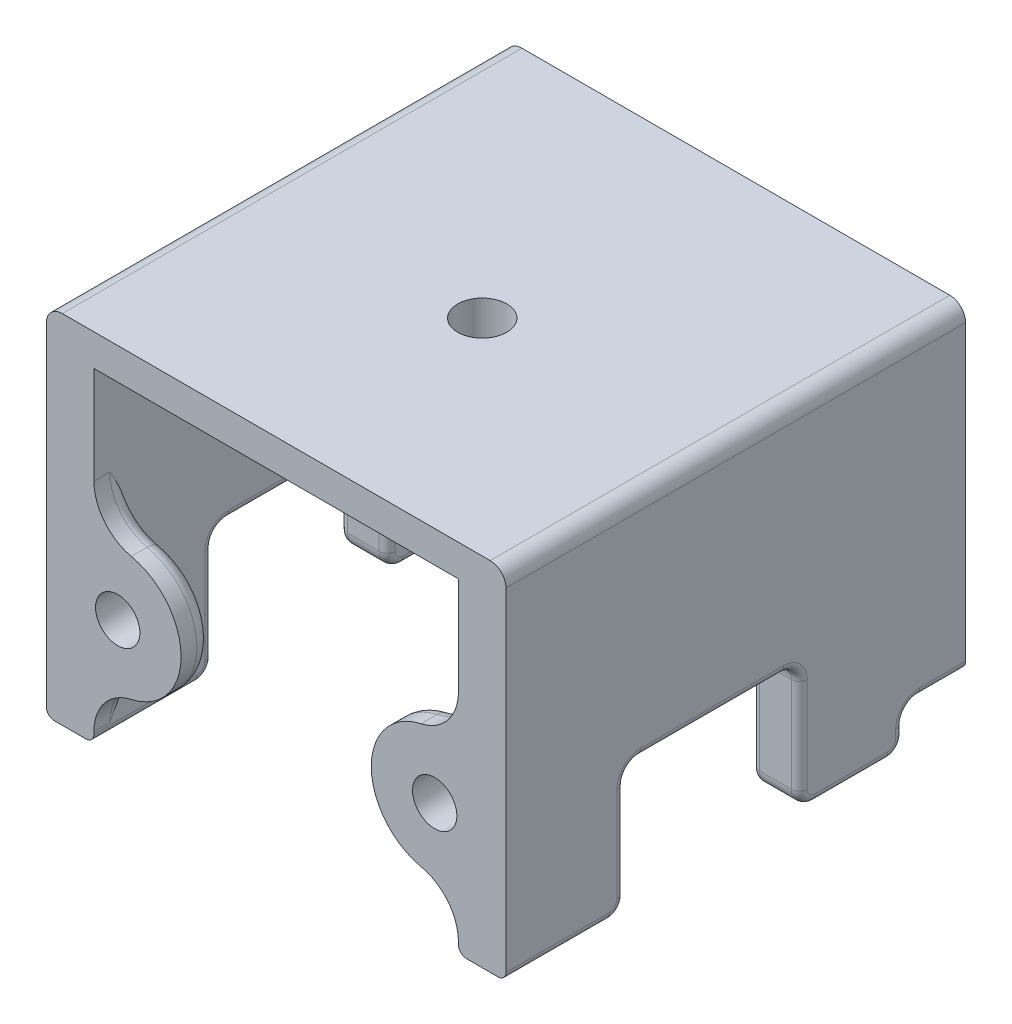
from build123d import *
from OCP.BRepFilletAPI import BRepFilletAPI_MakeChamfer

# Parameters (mm, degrees)
SKIZZE1_W                            = 58
SKIZZE1_H                            = 40
SKIZZE1_R                            = 2.4
SKIZZE1_R_2                          = 1.6
AUFSATZ_LINEAR_AUSTRAGEN1_DEPTH      = 8
AUFSATZ_LINEAR_AUSTRAGEN2_DEPTH      = 50
SCHNITT_LINEAR_AUSTRAGEN6_DEPTH      = 10
SCHNITT_LINEAR_AUSTRAGEN6_DEPTH_BACK = 4
SKIZZE10_R                           = 8
AUFSATZ_LINEAR_AUSTRAGEN3_DEPTH      = 4
SKIZZE13_W                           = 6
SKIZZE13_H                           = 50.174433159
AUFSATZ_LINEAR_AUSTRAGEN4_DEPTH      = 5
VERRUNDUNG1_R                        = 6
VERRUNDUNG3_R                        = 2
SKIZZE11_R                           = 2.8
SCHNITT_LINEAR_AUSTRAGEN7_DEPTH      = 4
SKIZZE7_R                            = 2
SCHNITT_LINEAR_AUSTRAGEN2_DEPTH      = 14
VERRUNDUNG4_R                        = 2
SKIZZE12_W                           = 58
SKIZZE12_H                           = 22
SCHNITT_LINEAR_AUSTRAGEN8_DEPTH      = 16
VERRUNDUNG5_R                        = 2
FASE4_SIZE                           = 4.5
FASE4_SIZE2                          = 1.205771366
LINEARES_MUSTER1_COUNT               = 2
LINEARES_MUSTER1_PITCH               = 52
VERRUNDUNG6_R                        = 1
SKIZZE16_R                           = 16
AUFSATZ_LINEAR_AUSTRAGEN7_DEPTH      = 20
FASE8_SIZE                           = 12
FASE8_SIZE2                          = 6.92820323
SKIZZE18_R                           = 3.1
SCHNITT_LINEAR_AUSTRAGEN10_DEPTH     = 20


# Read off the part's stored shape, not the designer's step: Aufsatz-Linear austragen2
with BuildPart() as part:
    # Skizze1 → Aufsatz-Linear austragen1 (new body)
    with BuildSketch(Plane.XY):
        with Locations((0, -20)):
            Rectangle(SKIZZE1_W, SKIZZE1_H)
        with Locations((-20, -10)):
            Circle(SKIZZE1_R, mode=Mode.SUBTRACT)
        with Locations((0, -10)):
            Circle(SKIZZE1_R, mode=Mode.SUBTRACT)
        with Locations((20, -10)):
            Circle(SKIZZE1_R, mode=Mode.SUBTRACT)
        with Locations((0, -30)):
            Circle(SKIZZE1_R, mode=Mode.SUBTRACT)
        with Locations((20, -30)):
            Circle(SKIZZE1_R, mode=Mode.SUBTRACT)
        with Locations((-20, -30)):
            Circle(SKIZZE1_R, mode=Mode.SUBTRACT)
        with Locations((-10, -20)):
            Circle(SKIZZE1_R_2, mode=Mode.SUBTRACT)
        with Locations((10, -20)):
            Circle(SKIZZE1_R_2, mode=Mode.SUBTRACT)
    extrude(amount=AUFSATZ_LINEAR_AUSTRAGEN1_DEPTH)

    # Aufsatz-Linear austragen2 outline → Aufsatz-Linear austragen2 (add)
    with BuildSketch(Plane.XY.offset(8)):
        Polygon((23, -40), (29, -40), (29, 0), (-29, 0), (-29, -40), (-23, -40), (-23, -4), (23, -4), align=None)
    extrude(amount=AUFSATZ_LINEAR_AUSTRAGEN2_DEPTH)

    # Skizze9 → Schnitt-Linear austragen6 (cut, two sides: drawn at the far end of the back side and taken through both)
    with BuildSketch(Plane.XY.offset(8).offset(-SCHNITT_LINEAR_AUSTRAGEN6_DEPTH_BACK)):
        Polygon((3.5, -7.979274058), (0, -5.958548116), (-3.5, -7.979274058), (-3.5, -12.020725942), (0, -14.041451884), (3.5, -12.020725942), align=None)
        Polygon((-16.5, -7.979274058), (-20, -5.958548116), (-23.5, -7.979274058), (-23.5, -12.020725942), (-20, -14.041451884), (-16.5, -12.020725942), align=None)
        Polygon((23.5, -7.979274058), (20, -5.958548116), (16.5, -7.979274058), (16.5, -12.020725942), (20, -14.041451884), (23.5, -12.020725942), align=None)
        Polygon((3.5, -27.979274058), (0, -25.958548116), (-3.5, -27.979274058), (-3.5, -32.020725942), (0, -34.041451884), (3.5, -32.020725942), align=None)
        Polygon((23.5, -27.979274058), (20, -25.958548116), (16.5, -27.979274058), (16.5, -32.020725942), (20, -34.041451884), (23.5, -32.020725942), align=None)
        Polygon((-16.5, -27.979274058), (-20, -25.958548116), (-23.5, -27.979274058), (-23.5, -32.020725942), (-20, -34.041451884), (-16.5, -32.020725942), align=None)
    extrude(amount=SCHNITT_LINEAR_AUSTRAGEN6_DEPTH + SCHNITT_LINEAR_AUSTRAGEN6_DEPTH_BACK, mode=Mode.SUBTRACT)

    # Skizze10 → Aufsatz-Linear austragen3 (add)
    with BuildSketch(Plane.XY.offset(58)):
        with Locations((20, -30)):
            Circle(SKIZZE10_R)
        with Locations((-20, -30)):
            Circle(SKIZZE10_R)
    extrude(amount=-AUFSATZ_LINEAR_AUSTRAGEN3_DEPTH)

    # Skizze13 → Aufsatz-Linear austragen4 (add)
    with BuildSketch(Plane.XZ.offset(40)):
        with Locations((-26, 32.912783421)):
            Rectangle(SKIZZE13_W, SKIZZE13_H)
        with Locations((26, 32.912783421)):
            Rectangle(SKIZZE13_W, SKIZZE13_H)
    extrude(amount=AUFSATZ_LINEAR_AUSTRAGEN4_DEPTH)

    # Verrundung1
    verrundung1_edges = [part.edges().sort_by_distance(p)[0] for p in [
        (23, -37.416198487, 56),
        (23, -22.583801513, 56),
        (-23, -37.416198487, 56),
        (-23, -22.583801513, 56),
    ]]
    fillet(verrundung1_edges, radius=VERRUNDUNG1_R)

    # Verrundung3
    # the kernel refuses this fillet: 2 mm, written as the material it takes off along each edge
    with BuildSketch(Plane(origin=(-20, -30, 54), x_dir=(0.21428571428571433, -0.9767710236555245, 0), z_dir=(-0.9767710236555245, -0.21428571428571433, 0))) as verrundung3_piece_1:
        with BuildLine():
            CenterArc((8 - VERRUNDUNG3_R, VERRUNDUNG3_R), VERRUNDUNG3_R, 270, 90)
            Line((8 - VERRUNDUNG3_R, 0), (8, 0))
            Line((8, 0), (8, VERRUNDUNG3_R))
        make_face()
    revolve(axis=Axis((-20, -30, 54), (0, 0, 1)), revolution_arc=155.252749768, mode=Mode.SUBTRACT)
    with BuildSketch(Plane(origin=(20, -30, 54), x_dir=(-0.21428571428571433, 0.9767710236555245, 0), z_dir=(0.9767710236555245, 0.21428571428571433, 0))) as verrundung3_piece_2:
        with BuildLine():
            CenterArc((8 - VERRUNDUNG3_R, VERRUNDUNG3_R), VERRUNDUNG3_R, 270, 90)
            Line((8 - VERRUNDUNG3_R, 0), (8, 0))
            Line((8, 0), (8, VERRUNDUNG3_R))
        make_face()
    revolve(axis=Axis((20, -30, 54), (0, 0, 1)), revolution_arc=155.252749768, mode=Mode.SUBTRACT)
    with BuildSketch(Plane(origin=(-17, -16.325205669, 54), x_dir=(-0.6722279054593165, 0.7403442733767718, 0), z_dir=(0.7403442733767718, 0.6722279054593165, 0))) as verrundung3_piece_3_section:
        with BuildLine():
            CenterArc((6 + VERRUNDUNG3_R, VERRUNDUNG3_R), VERRUNDUNG3_R, 180, 90)
            Line((6 + VERRUNDUNG3_R, 0), (6, 0))
            Line((6, 0), (6, VERRUNDUNG3_R))
        make_face()
    verrundung3_piece_3 = revolve(axis=Axis((-17, -16.325205669, 54), (0, 0, 1)), revolution_arc=125.387125524, mode=Mode.PRIVATE)
    verrundung3_piece_3 = split(verrundung3_piece_3, bisect_by=Plane(origin=(-23, -20.355034942, 54.516064296), z_dir=(1, 0, 0)), keep=Keep.TOP, mode=Mode.PRIVATE)
    add(verrundung3_piece_3, mode=Mode.SUBTRACT)
    with BuildSketch(Plane(origin=(-17, -43.674794331, 54), x_dir=(-0.6722279054593165, -0.7403442733767718, 0), z_dir=(0.7403442733767718, -0.6722279054593165, 0))) as verrundung3_piece_4_section:
        with BuildLine():
            CenterArc((6 + VERRUNDUNG3_R, -VERRUNDUNG3_R), VERRUNDUNG3_R, 90, 90)
            Line((6, -VERRUNDUNG3_R), (6, 0))
            Line((6, 0), (6 + VERRUNDUNG3_R, 0))
        make_face()
    verrundung3_piece_4 = revolve(axis=Axis((-17, -43.674794331, 54), (0, 0, -1)), revolution_arc=125.387125524, mode=Mode.PRIVATE)
    verrundung3_piece_4 = split(verrundung3_piece_4, bisect_by=Plane(origin=(-23, -39.644965239, 54.51606418), z_dir=(1, 0, 0)), keep=Keep.TOP, mode=Mode.PRIVATE)
    add(verrundung3_piece_4, mode=Mode.SUBTRACT)
    with BuildSketch(Plane(origin=(17, -43.674794331, 54), x_dir=(0.6722279054593165, -0.7403442733767718, 0), z_dir=(-0.7403442733767718, -0.6722279054593165, 0))) as verrundung3_piece_5_section:
        with BuildLine():
            CenterArc((6 + VERRUNDUNG3_R, VERRUNDUNG3_R), VERRUNDUNG3_R, 180, 90)
            Line((6 + VERRUNDUNG3_R, 0), (6, 0))
            Line((6, 0), (6, VERRUNDUNG3_R))
        make_face()
    verrundung3_piece_5 = revolve(axis=Axis((17, -43.674794331, 54), (0, 0, 1)), revolution_arc=125.387125524, mode=Mode.PRIVATE)
    verrundung3_piece_5 = split(verrundung3_piece_5, bisect_by=Plane(origin=(23, -39.644963205, 54.516060737), z_dir=(-1, 0, 0)), keep=Keep.TOP, mode=Mode.PRIVATE)
    add(verrundung3_piece_5, mode=Mode.SUBTRACT)
    with BuildSketch(Plane(origin=(17, -16.325205669, 54), x_dir=(0.672227905459316, 0.7403442733767723, 0), z_dir=(-0.7403442733767723, 0.672227905459316, 0))) as verrundung3_piece_6_section:
        with BuildLine():
            CenterArc((6 + VERRUNDUNG3_R, -VERRUNDUNG3_R), VERRUNDUNG3_R, 90, 90)
            Line((6, -VERRUNDUNG3_R), (6, 0))
            Line((6, 0), (6 + VERRUNDUNG3_R, 0))
        make_face()
    verrundung3_piece_6 = revolve(axis=Axis((17, -16.325205669, 54), (0, 0, -1)), revolution_arc=125.387125524, mode=Mode.PRIVATE)
    verrundung3_piece_6 = split(verrundung3_piece_6, bisect_by=Plane(origin=(23, -20.355037546, 54.516064213), z_dir=(-1, 0, 0)), keep=Keep.TOP, mode=Mode.PRIVATE)
    add(verrundung3_piece_6, mode=Mode.SUBTRACT)

    # Skizze11 → Schnitt-Linear austragen7 (cut)
    with BuildSketch(Plane.XY.offset(58)):
        with Locations((20, -30)):
            Circle(SKIZZE11_R)
        with Locations((-20, -30)):
            Circle(SKIZZE11_R)
    extrude(amount=-SCHNITT_LINEAR_AUSTRAGEN7_DEPTH, mode=Mode.SUBTRACT)

    # Skizze7 → Schnitt-Linear austragen2 (cut)
    with BuildSketch(Plane.XZ.offset(45)):
        with Locations(Location((26, 15.300827002, 0), (0, 0, 270))):
            Circle(SKIZZE7_R)
        with Locations(Location((26, 50.800827002, 0), (0, 0, 270))):
            Circle(SKIZZE7_R)
    schnitt_linear_austragen2 = extrude(amount=-SCHNITT_LINEAR_AUSTRAGEN2_DEPTH, mode=Mode.SUBTRACT)

    # Verrundung4
    verrundung4_edges = [part.edges().sort_by_distance(p)[0] for p in [
        (-29, 0, 29),
        (29, 0, 29),
    ]]
    fillet(verrundung4_edges, radius=VERRUNDUNG4_R)

    # Skizze12 → Schnitt-Linear austragen8 (cut)
    with BuildSketch(Plane.XZ.offset(45)):
        with Locations((0, 32)):
            Rectangle(SKIZZE12_W, SKIZZE12_H)
    extrude(amount=-SCHNITT_LINEAR_AUSTRAGEN8_DEPTH, mode=Mode.SUBTRACT)

    # Verrundung5
    verrundung5_edges = [part.edges().sort_by_distance(p)[0] for p in [
        (-26, -40, 7.825566841),
        (-26, -45, 7.825566841),
        (26, -40, 7.825566841),
        (26, -45, 7.825566841),
        (26, -45, 21),
        (-26, -45, 21),
        (-26, -45, 43),
        (-26, -29, 43),
        (-26, -29, 21),
        (26, -29, 43),
        (26, -29, 21),
        (26, -45, 43),
    ]]
    fillet(verrundung5_edges, radius=VERRUNDUNG5_R)

    # Fase4: one chamfer whose edges measure the first distance from different faces: ONE call of the kernel's chamfer builder (chamfer() names one face for all edges)
    fase4_edges_1 = [part.edges().sort_by_distance(p)[0] for p in [
        (-11.6, -20, 0),
    ]]
    fase4_side_1 = [part.faces().sort_by_distance(p)[0] for p in [
        (-11.6, -20, 4),
    ]]
    fase4_edges_2 = [part.edges().sort_by_distance(p)[0] for p in [
        (8.4, -20, 0),
    ]]
    fase4_side_2 = [part.faces().sort_by_distance(p)[0] for p in [
        (8.4, -20, 4),
    ]]
    fase4 = BRepFilletAPI_MakeChamfer(part.part.solid().wrapped)
    for e in fase4_edges_1:
        fase4.Add(FASE4_SIZE, FASE4_SIZE2, e.wrapped, fase4_side_1[0].wrapped)  # the first distance lies on this face
    for e in fase4_edges_2:
        fase4.Add(FASE4_SIZE, FASE4_SIZE2, e.wrapped, fase4_side_2[0].wrapped)  # the first distance lies on this face
    add(Compound.cast(fase4.Shape()), mode=Mode.REPLACE)

    # Lineares Muster1: Schnitt-Linear austragen2 ×2
    with Locations(*[(-i * LINEARES_MUSTER1_PITCH, 0, 0) for i in range(1, LINEARES_MUSTER1_COUNT)]):
        add(schnitt_linear_austragen2, mode=Mode.SUBTRACT)

    # Verrundung6
    # the kernel refuses this fillet: 1 mm, written as the material it takes off along each edge
    with BuildSketch(Plane(origin=(-23, -42, 5.825566841), x_dir=(0, 0.3148458040869784, -0.9491428341660828), z_dir=(0, -0.9491428341660828, -0.3148458040869784))) as verrundung6_piece_1_section:
        with BuildLine():
            CenterArc((2 + VERRUNDUNG6_R, -VERRUNDUNG6_R), VERRUNDUNG6_R, 90, 90)
            Line((2, -VERRUNDUNG6_R), (2, 0))
            Line((2, 0), (2 + VERRUNDUNG6_R, 0))
        make_face()
    verrundung6_piece_1 = revolve(axis=Axis((-23, -42, 5.825566841), (1, 0, 0)), revolution_arc=161.648494619, mode=Mode.PRIVATE)
    verrundung6_piece_1 = split(verrundung6_piece_1, bisect_by=Plane(origin=(-23.272151062, -40, 7.287763131), z_dir=(0, -1, 0)), keep=Keep.TOP, mode=Mode.PRIVATE)
    add(verrundung6_piece_1, mode=Mode.SUBTRACT)
    with BuildSketch(Plane(origin=(-23, -42, 5.825566841), x_dir=(0, 0.3148458040869784, -0.9491428341660828), z_dir=(0, -0.9491428341660828, -0.3148458040869784))) as verrundung6_piece_2_section:
        with BuildLine():
            CenterArc((2 + VERRUNDUNG6_R, -VERRUNDUNG6_R), VERRUNDUNG6_R, 90, 90)
            Line((2, -VERRUNDUNG6_R), (2, 0))
            Line((2, 0), (2 + VERRUNDUNG6_R, 0))
        make_face()
    verrundung6_piece_2 = revolve(axis=Axis((-23, -42, 5.825566841), (1, 0, 0)), revolution_arc=161.648494619, mode=Mode.PRIVATE)
    verrundung6_piece_2 = split(verrundung6_piece_2, bisect_by=Plane(origin=(-23.00020869, -39.986552232, 8), z_dir=(0, 0, 1)), keep=Keep.TOP, mode=Mode.PRIVATE)
    add(verrundung6_piece_2, mode=Mode.SUBTRACT)
    with BuildSketch(Plane(origin=(-23, -42, 7.825566841), x_dir=(0, 0, 1), z_dir=(0, -1, 0)), Plane(origin=(29, -42, 7.825566841), x_dir=(0, 0, 1), z_dir=(0, -1, 0))) as verrundung6_piece_3:
        with BuildLine():
            CenterArc((VERRUNDUNG6_R, VERRUNDUNG6_R), VERRUNDUNG6_R, 180, 90)
            Line((0, VERRUNDUNG6_R), (0, 0))
            Line((0, 0), (VERRUNDUNG6_R, 0))
        make_face()
    extrude(amount=1, mode=Mode.SUBTRACT)
    with BuildSketch(Plane(origin=(-23, -43, 9.825566841), x_dir=(0, -1, 0), z_dir=(0, 0, 1))) as verrundung6_piece_4:
        with BuildLine():
            CenterArc((2 - VERRUNDUNG6_R, -VERRUNDUNG6_R), VERRUNDUNG6_R, 0, 90)
            Line((2, -VERRUNDUNG6_R), (2, 0))
            Line((2, 0), (2 - VERRUNDUNG6_R, 0))
        make_face()
    revolve(axis=Axis((-23, -43, 9.825566841), (1, 0, 0)), revolution_arc=90, mode=Mode.SUBTRACT)
    with BuildSketch(Plane(origin=(-23, -45, 19), x_dir=(0, 1, 0), z_dir=(0, 0, -1)), Plane(origin=(-29, -45, 9.825566841), x_dir=(0, 1, 0), z_dir=(0, 0, 1)), Plane(origin=(23, -45, 9.825566841), x_dir=(0, 1, 0), z_dir=(0, 0, 1)), Plane(origin=(29, -45, 19), x_dir=(0, 1, 0), z_dir=(0, 0, -1))) as verrundung6_piece_5:
        with BuildLine():
            CenterArc((VERRUNDUNG6_R, -VERRUNDUNG6_R), VERRUNDUNG6_R, 90, 90)
            Line((0, -VERRUNDUNG6_R), (0, 0))
            Line((0, 0), (VERRUNDUNG6_R, 0))
        make_face()
    extrude(amount=9.174433159, mode=Mode.SUBTRACT)
    with BuildSketch(Plane(origin=(-23, -43, 19), x_dir=(0, 0, 1), z_dir=(0, 1, 0))) as verrundung6_piece_6:
        with BuildLine():
            CenterArc((2 - VERRUNDUNG6_R, -VERRUNDUNG6_R), VERRUNDUNG6_R, 0, 90)
            Line((2, -VERRUNDUNG6_R), (2, 0))
            Line((2, 0), (2 - VERRUNDUNG6_R, 0))
        make_face()
    revolve(axis=Axis((-23, -43, 19), (1, 0, 0)), revolution_arc=90, mode=Mode.SUBTRACT)
    with BuildSketch(Plane(origin=(-23, -43, 21), x_dir=(0, 0, -1), z_dir=(0, 1, 0)), Plane(origin=(-23, -31, 43), x_dir=(0, 0, 1), z_dir=(0, -1, 0)), Plane(origin=(-29, -43, 43), x_dir=(0, 0, 1), z_dir=(0, 1, 0)), Plane(origin=(23, -31, 21), x_dir=(0, 0, -1), z_dir=(0, -1, 0)), Plane(origin=(23, -43, 43), x_dir=(0, 0, 1), z_dir=(0, 1, 0)), Plane(origin=(29, -43, 21), x_dir=(0, 0, -1), z_dir=(0, 1, 0))) as verrundung6_piece_7:
        with BuildLine():
            CenterArc((VERRUNDUNG6_R, VERRUNDUNG6_R), VERRUNDUNG6_R, 180, 90)
            Line((0, VERRUNDUNG6_R), (0, 0))
            Line((0, 0), (VERRUNDUNG6_R, 0))
        make_face()
    extrude(amount=12, mode=Mode.SUBTRACT)
    with BuildSketch(Plane(origin=(-23, -31, 23), x_dir=(0, 1, 0), z_dir=(0, 0, 1))) as verrundung6_piece_8:
        with BuildLine():
            CenterArc((2 + VERRUNDUNG6_R, VERRUNDUNG6_R), VERRUNDUNG6_R, 180, 90)
            Line((2, VERRUNDUNG6_R), (2, 0))
            Line((2, 0), (2 + VERRUNDUNG6_R, 0))
        make_face()
    revolve(axis=Axis((-23, -31, 23), (-1, 0, 0)), revolution_arc=90, mode=Mode.SUBTRACT)
    with BuildSketch(Plane(origin=(-23, -29, 41), x_dir=(0, 1, 0), z_dir=(0, 0, -1)), Plane(origin=(-29, -29, 23), x_dir=(0, 1, 0), z_dir=(0, 0, 1)), Plane(origin=(23, -29, 23), x_dir=(0, 1, 0), z_dir=(0, 0, 1)), Plane(origin=(29, -29, 41), x_dir=(0, 1, 0), z_dir=(0, 0, -1))) as verrundung6_piece_9:
        with BuildLine():
            CenterArc((VERRUNDUNG6_R, -VERRUNDUNG6_R), VERRUNDUNG6_R, 90, 90)
            Line((0, -VERRUNDUNG6_R), (0, 0))
            Line((0, 0), (VERRUNDUNG6_R, 0))
        make_face()
    extrude(amount=18, mode=Mode.SUBTRACT)
    with BuildSketch(Plane(origin=(-23, -31, 41), x_dir=(0, 0, 1), z_dir=(0, -1, 0))) as verrundung6_piece_10:
        with BuildLine():
            CenterArc((2 + VERRUNDUNG6_R, VERRUNDUNG6_R), VERRUNDUNG6_R, 180, 90)
            Line((2, VERRUNDUNG6_R), (2, 0))
            Line((2, 0), (2 + VERRUNDUNG6_R, 0))
        make_face()
    revolve(axis=Axis((-23, -31, 41), (-1, 0, 0)), revolution_arc=90, mode=Mode.SUBTRACT)
    with BuildSketch(Plane(origin=(-23, -43, 45), x_dir=(0, -1, 0), z_dir=(0, 0, 1))) as verrundung6_piece_11:
        with BuildLine():
            CenterArc((2 - VERRUNDUNG6_R, -VERRUNDUNG6_R), VERRUNDUNG6_R, 0, 90)
            Line((2, -VERRUNDUNG6_R), (2, 0))
            Line((2, 0), (2 - VERRUNDUNG6_R, 0))
        make_face()
    revolve(axis=Axis((-23, -43, 45), (1, 0, 0)), revolution_arc=90, mode=Mode.SUBTRACT)
    with BuildSketch(Plane(origin=(-29, -40, -2.5), x_dir=(1, 0, 0), z_dir=(0, 0, 1)), Plane(origin=(29, -40, 5.825566841), x_dir=(-1, 0, 0), z_dir=(0, 0, -1))) as verrundung6_piece_12:
        with BuildLine():
            CenterArc((VERRUNDUNG6_R, VERRUNDUNG6_R), VERRUNDUNG6_R, 180, 90)
            Line((0, VERRUNDUNG6_R), (0, 0))
            Line((0, 0), (VERRUNDUNG6_R, 0))
        make_face()
    extrude(amount=8.325566841, mode=Mode.SUBTRACT)
    with BuildSketch(Plane(origin=(-29, -42, 5.825566841), x_dir=(0, 1, 0), z_dir=(0, 0, -1))) as verrundung6_piece_13:
        with BuildLine():
            CenterArc((2 + VERRUNDUNG6_R, VERRUNDUNG6_R), VERRUNDUNG6_R, 180, 90)
            Line((2, VERRUNDUNG6_R), (2, 0))
            Line((2, 0), (2 + VERRUNDUNG6_R, 0))
        make_face()
    revolve(axis=Axis((-29, -42, 5.825566841), (1, 0, 0)), revolution_arc=90, mode=Mode.SUBTRACT)
    with BuildSketch(Plane(origin=(-29, -42, 7.825566841), x_dir=(0, 0, 1), z_dir=(0, -1, 0)), Plane(origin=(23, -42, 7.825566841), x_dir=(0, 0, 1), z_dir=(0, -1, 0))) as verrundung6_piece_14:
        with BuildLine():
            CenterArc((VERRUNDUNG6_R, -VERRUNDUNG6_R), VERRUNDUNG6_R, 90, 90)
            Line((0, -VERRUNDUNG6_R), (0, 0))
            Line((0, 0), (VERRUNDUNG6_R, 0))
        make_face()
    extrude(amount=1, mode=Mode.SUBTRACT)
    with BuildSketch(Plane(origin=(-29, -43, 9.825566841), x_dir=(0, -1, 0), z_dir=(0, 0, 1))) as verrundung6_piece_15:
        with BuildLine():
            CenterArc((2 - VERRUNDUNG6_R, VERRUNDUNG6_R), VERRUNDUNG6_R, 270, 90)
            Line((2, VERRUNDUNG6_R), (2, 0))
            Line((2, 0), (2 - VERRUNDUNG6_R, 0))
        make_face()
    revolve(axis=Axis((-29, -43, 9.825566841), (1, 0, 0)), revolution_arc=90, mode=Mode.SUBTRACT)
    with BuildSketch(Plane(origin=(-29, -43, 19), x_dir=(0, 0, 1), z_dir=(0, 1, 0))) as verrundung6_piece_16:
        with BuildLine():
            CenterArc((2 - VERRUNDUNG6_R, VERRUNDUNG6_R), VERRUNDUNG6_R, 270, 90)
            Line((2, VERRUNDUNG6_R), (2, 0))
            Line((2, 0), (2 - VERRUNDUNG6_R, 0))
        make_face()
    revolve(axis=Axis((-29, -43, 19), (1, 0, 0)), revolution_arc=90, mode=Mode.SUBTRACT)
    with BuildSketch(Plane(origin=(-29, -43, 21), x_dir=(0, 0, -1), z_dir=(0, 1, 0)), Plane(origin=(29, -43, 43), x_dir=(0, 0, 1), z_dir=(0, 1, 0))) as verrundung6_piece_17:
        with BuildLine():
            CenterArc((VERRUNDUNG6_R, -VERRUNDUNG6_R), VERRUNDUNG6_R, 90, 90)
            Line((0, -VERRUNDUNG6_R), (0, 0))
            Line((0, 0), (VERRUNDUNG6_R, 0))
        make_face()
    extrude(amount=12, mode=Mode.SUBTRACT)
    with BuildSketch(Plane(origin=(-29, -31, 23), x_dir=(0, 1, 0), z_dir=(0, 0, 1))) as verrundung6_piece_18:
        with BuildLine():
            CenterArc((2 + VERRUNDUNG6_R, -VERRUNDUNG6_R), VERRUNDUNG6_R, 90, 90)
            Line((2, -VERRUNDUNG6_R), (2, 0))
            Line((2, 0), (2 + VERRUNDUNG6_R, 0))
        make_face()
    revolve(axis=Axis((-29, -31, 23), (-1, 0, 0)), revolution_arc=90, mode=Mode.SUBTRACT)
    with BuildSketch(Plane(origin=(-29, -31, 41), x_dir=(0, 0, 1), z_dir=(0, -1, 0))) as verrundung6_piece_19:
        with BuildLine():
            CenterArc((2 + VERRUNDUNG6_R, -VERRUNDUNG6_R), VERRUNDUNG6_R, 90, 90)
            Line((2, -VERRUNDUNG6_R), (2, 0))
            Line((2, 0), (2 + VERRUNDUNG6_R, 0))
        make_face()
    revolve(axis=Axis((-29, -31, 41), (-1, 0, 0)), revolution_arc=90, mode=Mode.SUBTRACT)
    with BuildSketch(Plane(origin=(-29, -43, 45), x_dir=(0, -1, 0), z_dir=(0, 0, 1))) as verrundung6_piece_20:
        with BuildLine():
            CenterArc((2 - VERRUNDUNG6_R, VERRUNDUNG6_R), VERRUNDUNG6_R, 270, 90)
            Line((2, VERRUNDUNG6_R), (2, 0))
            Line((2, 0), (2 - VERRUNDUNG6_R, 0))
        make_face()
    revolve(axis=Axis((-29, -43, 45), (1, 0, 0)), revolution_arc=90, mode=Mode.SUBTRACT)
    with BuildSketch(Plane(origin=(-23, -45, 60.5), x_dir=(0, 1, 0), z_dir=(0, 0, -1)), Plane(origin=(-29, -45, 45), x_dir=(0, 1, 0), z_dir=(0, 0, 1)), Plane(origin=(23, -45, 45), x_dir=(0, 1, 0), z_dir=(0, 0, 1)), Plane(origin=(29, -45, 60.5), x_dir=(0, 1, 0), z_dir=(0, 0, -1))) as verrundung6_piece_21:
        with BuildLine():
            CenterArc((VERRUNDUNG6_R, -VERRUNDUNG6_R), VERRUNDUNG6_R, 90, 90)
            Line((0, -VERRUNDUNG6_R), (0, 0))
            Line((0, 0), (VERRUNDUNG6_R, 0))
        make_face()
    extrude(amount=15.5, mode=Mode.SUBTRACT)
    with BuildSketch(Plane(origin=(23, -42, 5.825566841), x_dir=(0, 0.3148458040869784, -0.9491428341660828), z_dir=(0, -0.9491428341660828, -0.3148458040869784))) as verrundung6_piece_22_section:
        with BuildLine():
            CenterArc((2 + VERRUNDUNG6_R, VERRUNDUNG6_R), VERRUNDUNG6_R, 180, 90)
            Line((2, VERRUNDUNG6_R), (2, 0))
            Line((2, 0), (2 + VERRUNDUNG6_R, 0))
        make_face()
    verrundung6_piece_22 = revolve(axis=Axis((23, -42, 5.825566841), (1, 0, 0)), revolution_arc=161.648494619, mode=Mode.PRIVATE)
    verrundung6_piece_22 = split(verrundung6_piece_22, bisect_by=Plane(origin=(23.272151116, -40, 7.287763135), z_dir=(0, -1, 0)), keep=Keep.TOP, mode=Mode.PRIVATE)
    add(verrundung6_piece_22, mode=Mode.SUBTRACT)
    with BuildSketch(Plane(origin=(23, -42, 5.825566841), x_dir=(0, 0.3148458040869784, -0.9491428341660828), z_dir=(0, -0.9491428341660828, -0.3148458040869784))) as verrundung6_piece_23_section:
        with BuildLine():
            CenterArc((2 + VERRUNDUNG6_R, VERRUNDUNG6_R), VERRUNDUNG6_R, 180, 90)
            Line((2, VERRUNDUNG6_R), (2, 0))
            Line((2, 0), (2 + VERRUNDUNG6_R, 0))
        make_face()
    verrundung6_piece_23 = revolve(axis=Axis((23, -42, 5.825566841), (1, 0, 0)), revolution_arc=161.648494619, mode=Mode.PRIVATE)
    verrundung6_piece_23 = split(verrundung6_piece_23, bisect_by=Plane(origin=(23.00020869, -39.986552232, 8), z_dir=(0, 0, 1)), keep=Keep.TOP, mode=Mode.PRIVATE)
    add(verrundung6_piece_23, mode=Mode.SUBTRACT)
    with BuildSketch(Plane(origin=(23, -43, 9.825566841), x_dir=(0, 0, -1), z_dir=(0, 1, 0))) as verrundung6_piece_24:
        with BuildLine():
            CenterArc((2 - VERRUNDUNG6_R, -VERRUNDUNG6_R), VERRUNDUNG6_R, 0, 90)
            Line((2, -VERRUNDUNG6_R), (2, 0))
            Line((2, 0), (2 - VERRUNDUNG6_R, 0))
        make_face()
    revolve(axis=Axis((23, -43, 9.825566841), (-1, 0, 0)), revolution_arc=90, mode=Mode.SUBTRACT)
    with BuildSketch(Plane(origin=(23, -43, 19), x_dir=(0, -1, 0), z_dir=(0, 0, -1))) as verrundung6_piece_25:
        with BuildLine():
            CenterArc((2 - VERRUNDUNG6_R, -VERRUNDUNG6_R), VERRUNDUNG6_R, 0, 90)
            Line((2, -VERRUNDUNG6_R), (2, 0))
            Line((2, 0), (2 - VERRUNDUNG6_R, 0))
        make_face()
    revolve(axis=Axis((23, -43, 19), (-1, 0, 0)), revolution_arc=90, mode=Mode.SUBTRACT)
    with BuildSketch(Plane(origin=(23, -31, 23), x_dir=(0, 0, -1), z_dir=(0, -1, 0))) as verrundung6_piece_26:
        with BuildLine():
            CenterArc((2 + VERRUNDUNG6_R, VERRUNDUNG6_R), VERRUNDUNG6_R, 180, 90)
            Line((2, VERRUNDUNG6_R), (2, 0))
            Line((2, 0), (2 + VERRUNDUNG6_R, 0))
        make_face()
    revolve(axis=Axis((23, -31, 23), (1, 0, 0)), revolution_arc=90, mode=Mode.SUBTRACT)
    with BuildSketch(Plane(origin=(23, -31, 41), x_dir=(0, 1, 0), z_dir=(0, 0, -1))) as verrundung6_piece_27:
        with BuildLine():
            CenterArc((2 + VERRUNDUNG6_R, VERRUNDUNG6_R), VERRUNDUNG6_R, 180, 90)
            Line((2, VERRUNDUNG6_R), (2, 0))
            Line((2, 0), (2 + VERRUNDUNG6_R, 0))
        make_face()
    revolve(axis=Axis((23, -31, 41), (1, 0, 0)), revolution_arc=90, mode=Mode.SUBTRACT)
    with BuildSketch(Plane(origin=(23, -43, 45), x_dir=(0, -1, 0), z_dir=(0, 0, 1))) as verrundung6_piece_28:
        with BuildLine():
            CenterArc((2 - VERRUNDUNG6_R, VERRUNDUNG6_R), VERRUNDUNG6_R, 270, 90)
            Line((2, VERRUNDUNG6_R), (2, 0))
            Line((2, 0), (2 - VERRUNDUNG6_R, 0))
        make_face()
    revolve(axis=Axis((23, -43, 45), (1, 0, 0)), revolution_arc=90, mode=Mode.SUBTRACT)
    with BuildSketch(Plane(origin=(29, -42, 5.825566841), x_dir=(0, 1, 0), z_dir=(0, 0, -1))) as verrundung6_piece_29:
        with BuildLine():
            CenterArc((2 + VERRUNDUNG6_R, -VERRUNDUNG6_R), VERRUNDUNG6_R, 90, 90)
            Line((2, -VERRUNDUNG6_R), (2, 0))
            Line((2, 0), (2 + VERRUNDUNG6_R, 0))
        make_face()
    revolve(axis=Axis((29, -42, 5.825566841), (1, 0, 0)), revolution_arc=90, mode=Mode.SUBTRACT)
    with BuildSketch(Plane(origin=(29, -43, 9.825566841), x_dir=(0, 0, -1), z_dir=(0, 1, 0))) as verrundung6_piece_30:
        with BuildLine():
            CenterArc((2 - VERRUNDUNG6_R, VERRUNDUNG6_R), VERRUNDUNG6_R, 270, 90)
            Line((2, VERRUNDUNG6_R), (2, 0))
            Line((2, 0), (2 - VERRUNDUNG6_R, 0))
        make_face()
    revolve(axis=Axis((29, -43, 9.825566841), (-1, 0, 0)), revolution_arc=90, mode=Mode.SUBTRACT)
    with BuildSketch(Plane(origin=(29, -43, 19), x_dir=(0, -1, 0), z_dir=(0, 0, -1))) as verrundung6_piece_31:
        with BuildLine():
            CenterArc((2 - VERRUNDUNG6_R, VERRUNDUNG6_R), VERRUNDUNG6_R, 270, 90)
            Line((2, VERRUNDUNG6_R), (2, 0))
            Line((2, 0), (2 - VERRUNDUNG6_R, 0))
        make_face()
    revolve(axis=Axis((29, -43, 19), (-1, 0, 0)), revolution_arc=90, mode=Mode.SUBTRACT)
    with BuildSketch(Plane(origin=(29, -31, 23), x_dir=(0, 0, -1), z_dir=(0, -1, 0))) as verrundung6_piece_32:
        with BuildLine():
            CenterArc((2 + VERRUNDUNG6_R, -VERRUNDUNG6_R), VERRUNDUNG6_R, 90, 90)
            Line((2, -VERRUNDUNG6_R), (2, 0))
            Line((2, 0), (2 + VERRUNDUNG6_R, 0))
        make_face()
    revolve(axis=Axis((29, -31, 23), (1, 0, 0)), revolution_arc=90, mode=Mode.SUBTRACT)
    with BuildSketch(Plane(origin=(29, -31, 41), x_dir=(0, 1, 0), z_dir=(0, 0, -1))) as verrundung6_piece_33:
        with BuildLine():
            CenterArc((2 + VERRUNDUNG6_R, -VERRUNDUNG6_R), VERRUNDUNG6_R, 90, 90)
            Line((2, -VERRUNDUNG6_R), (2, 0))
            Line((2, 0), (2 + VERRUNDUNG6_R, 0))
        make_face()
    revolve(axis=Axis((29, -31, 41), (1, 0, 0)), revolution_arc=90, mode=Mode.SUBTRACT)
    with BuildSketch(Plane(origin=(29, -43, 45), x_dir=(0, -1, 0), z_dir=(0, 0, 1))) as verrundung6_piece_34:
        with BuildLine():
            CenterArc((2 - VERRUNDUNG6_R, -VERRUNDUNG6_R), VERRUNDUNG6_R, 0, 90)
            Line((2, -VERRUNDUNG6_R), (2, 0))
            Line((2, 0), (2 - VERRUNDUNG6_R, 0))
        make_face()
    revolve(axis=Axis((29, -43, 45), (1, 0, 0)), revolution_arc=90, mode=Mode.SUBTRACT)

    # Skizze16 → Aufsatz-Linear austragen7 (add)
    with BuildSketch(Plane(origin=(0, 0, 0), x_dir=(1, 0, 0), z_dir=(0, 1, 0))):
        with Locations(Location((0, -32, 0), (0, 0, 270))):
            Circle(SKIZZE16_R)
    extrude(amount=-AUFSATZ_LINEAR_AUSTRAGEN7_DEPTH)

    # Fase8
    fase8_edges = [part.edges().sort_by_distance(p)[0] for p in [
        (0, -20, 16),
    ]]
    fase8_side = [part.faces().sort_by_distance(p)[0] for p in [
        (0, -12, 16),
    ]]
    chamfer(fase8_edges, length=FASE8_SIZE, length2=FASE8_SIZE2, reference=fase8_side[0])

    # Skizze18 → Schnitt-Linear austragen10 (cut)
    with BuildSketch(Plane(origin=(0, 0, 0), x_dir=(1, 0, 0), z_dir=(0, 1, 0))):
        with Locations(Location((0, -32, 0), (0, 0, 270))):
            Circle(SKIZZE18_R)
    extrude(amount=-SCHNITT_LINEAR_AUSTRAGEN10_DEPTH, mode=Mode.SUBTRACT)


solid = part.part
